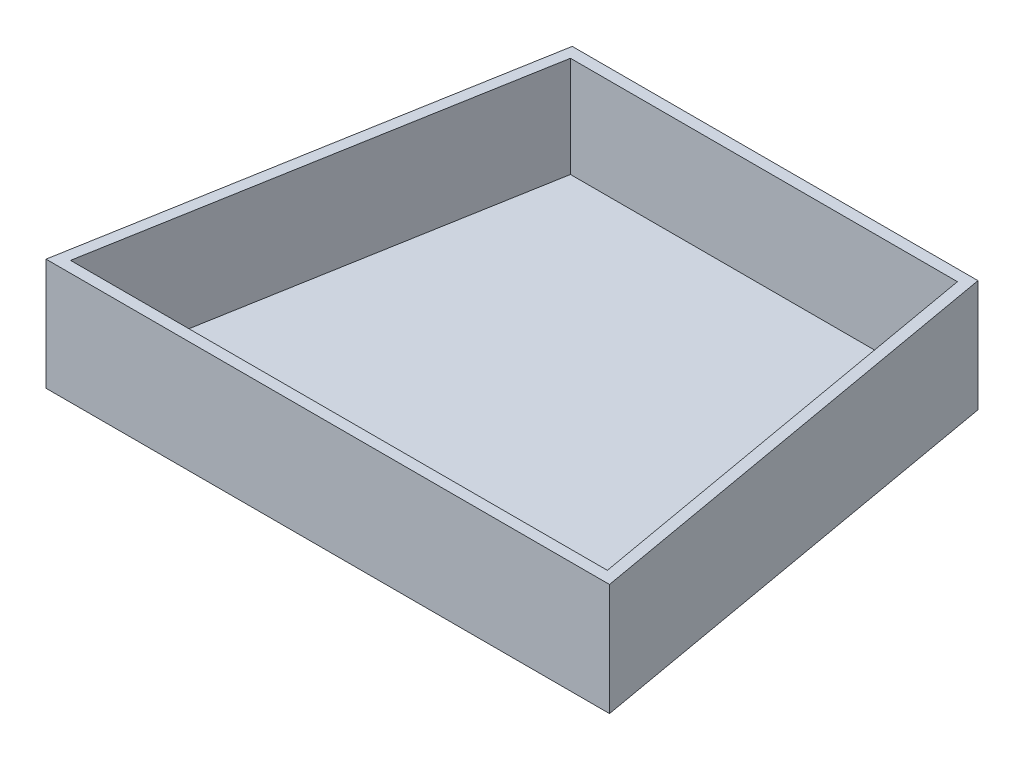
from build123d import *

# Parameters (mm, degrees)
EXTRUDE_THIN1_DEPTH = 50
BOSS_EXTRUDE1_DEPTH = 5


with BuildPart() as part:
    # Sketch1 → Extrude-Thin1 (new body)
    with BuildSketch(Plane(origin=(0, 0, 0), x_dir=(1, 0, 0), z_dir=(0, 1, 0))):
        Polygon((245.958767963, -5), (-5.958767963, -5), (29.306628179, 195), (210.693371821, 195), align=None)
        Polygon((240, 0), (0, 0), (33.502126335, 190), (206.497873665, 190), align=None, mode=Mode.SUBTRACT)
    extrude(amount=EXTRUDE_THIN1_DEPTH)


with BuildPart() as body_2:
    # Sketch1<3> → Boss-Extrude1 (new body)
    with BuildSketch(Plane(origin=(0, 0, 0), x_dir=(1, 0, 0), z_dir=(0, 1, 0))):
        Polygon((0, 0), (33.502126335, 190), (206.497873665, 190), (240, 0), align=None)
    extrude(amount=BOSS_EXTRUDE1_DEPTH)


solid = Compound([part.part, body_2.part])
